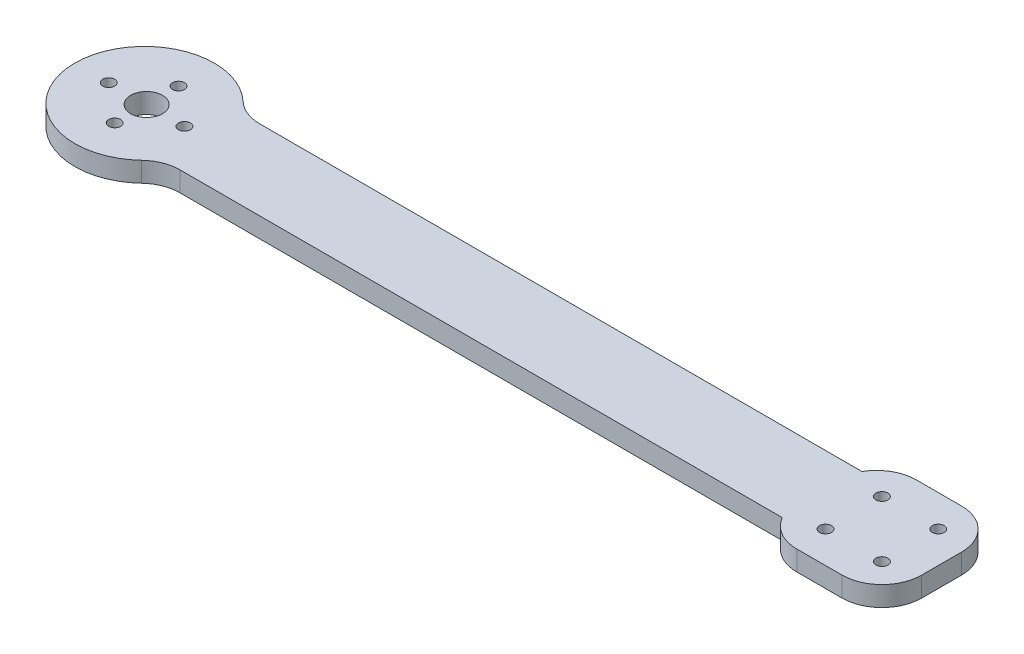
from build123d import *

# Parameters (mm, degrees)
BOSS_EXTRUDE1_DEPTH = 5
SKETCH2_R           = 4
SKETCH2_R_2         = 1.5
CUT_EXTRUDE1_DEPTH  = 5
SKETCH3_R           = 1.5
CUT_EXTRUDE2_DEPTH  = 5
FILLET3_R           = 10
FILLET4_R           = 10


with BuildPart() as part:
    # Sketch1 → Boss-Extrude1 (new body)
    with BuildSketch(Plane(origin=(0, 0, 0), x_dir=(1, 0, 0), z_dir=(0, 1, 0))):
        Polygon((-85.638593384, 10), (-100, 10), (-100, -10), (-85.638593384, -10), (70, -10), (70, -15), (100, -15), (100, -10), (100, 10), (100, 15), (70, 15), (70, 10), align=None)
        with BuildLine():
            Line((-100, -10), (-100, 10))
            Line((-100, 10), (-85.638593384, 10))
            ThreePointArc((-85.638593384, 10), (-117.5, 0), (-85.638593384, -10))
            Line((-85.638593384, -10), (-100, -10))
        make_face()
    extrude(amount=BOSS_EXTRUDE1_DEPTH)

    # Sketch2 → Cut-Extrude1 (cut)
    with BuildSketch(Plane(origin=(0, 5, 0), x_dir=(1, 0, 0), z_dir=(0, 1, 0))):
        with Locations(Location((-99.485581351, 0, 0), (0, 0, 270))):
            Circle(SKETCH2_R)
        with Locations(Location((-99.485581351, 8, 0), (0, 0, 270))):
            Circle(SKETCH2_R_2)
        with Locations(Location((-99.485581351, -8, 0), (0, 0, 270))):
            Circle(SKETCH2_R_2)
        with Locations(Location((-108.985581351, 0, 0), (0, 0, 270))):
            Circle(SKETCH2_R_2)
        with Locations(Location((-89.985581351, 0, 0), (0, 0, 270))):
            Circle(SKETCH2_R_2)
    extrude(amount=-CUT_EXTRUDE1_DEPTH, mode=Mode.SUBTRACT)

    # Sketch3 → Cut-Extrude2 (cut)
    with BuildSketch(Plane(origin=(0, 5, 0), x_dir=(1, 0, 0), z_dir=(0, 1, 0))):
        with Locations(Location((77.928932188, 7.071067812, 0), (0, 0, 270))):
            Circle(SKETCH3_R)
        with Locations(Location((92.071067812, 7.071067812, 0), (0, 0, 270))):
            Circle(SKETCH3_R)
        with Locations(Location((92.071067812, -7.071067812, 0), (0, 0, 270))):
            Circle(SKETCH3_R)
        with Locations(Location((77.928932188, -7.071067812, 0), (0, 0, 270))):
            Circle(SKETCH3_R)
    extrude(amount=-CUT_EXTRUDE2_DEPTH, mode=Mode.SUBTRACT)

    # Fillet3
    # the kernel refuses this fillet: 10 mm, written as the material it takes off along each edge
    with BuildSketch(Plane(origin=(70, -21.650635095, 15), x_dir=(0, 0, -1), z_dir=(0, 1, 0))) as fillet3_piece_1:
        with BuildLine():
            CenterArc((10, -8.660254038), FILLET3_R, 120, 60)
            Line((0, -8.660254038), (-0.2, -8.660254038))
            Line((-0.2, -8.660254038), (-0.2, 0))
            Line((-0.2, 0), (0, 0.2))
            ThreePointArc((0, 0.2), (2.5, 0.2), (4.9, 0.173205081))
            Line((4.9, 0.173205081), (5, 0))
        make_face()
    extrude(amount=48.301270189, mode=Mode.SUBTRACT)
    with BuildSketch(Plane(origin=(100, -25, 15), x_dir=(0, 0, -1), z_dir=(0, 1, 0)), Plane(origin=(100, -25, -15), x_dir=(-1, 0, 0), z_dir=(0, 1, 0))) as fillet3_piece_2:
        with BuildLine():
            CenterArc((FILLET3_R, FILLET3_R), FILLET3_R, 180, 90)
            Line((0, FILLET3_R), (-FILLET3_R * 0.02, FILLET3_R))
            Line((-FILLET3_R * 0.02, FILLET3_R), (-FILLET3_R * 0.02, -FILLET3_R * 0.02))
            Line((-FILLET3_R * 0.02, -FILLET3_R * 0.02), (FILLET3_R, -FILLET3_R * 0.02))
            Line((FILLET3_R, -FILLET3_R * 0.02), (FILLET3_R, 0))
        make_face()
    extrude(amount=55, mode=Mode.SUBTRACT)
    with BuildSketch(Plane(origin=(70, -21.650635095, -15), x_dir=(0, 0, 1), z_dir=(0, 1, 0))) as fillet3_piece_3:
        with BuildLine():
            CenterArc((10, 8.660254038), FILLET3_R, 180, 60)
            Line((0, 8.660254038), (-0.2, 8.660254038))
            Line((-0.2, 8.660254038), (-0.2, 0))
            Line((-0.2, 0), (0, -0.2))
            ThreePointArc((0, -0.2), (2.5, -0.2), (4.9, -0.173205081))
            Line((4.9, -0.173205081), (5, 0))
        make_face()
    extrude(amount=48.301270189, mode=Mode.SUBTRACT)

    # Fillet4
    fillet4_edges = [part.edges().sort_by_distance(p)[0] for p in [
        (-85.638593384, 2.5, -10),
        (-85.638593384, 2.5, 10),
    ]]
    fillet(fillet4_edges, radius=FILLET4_R)


solid = part.part
